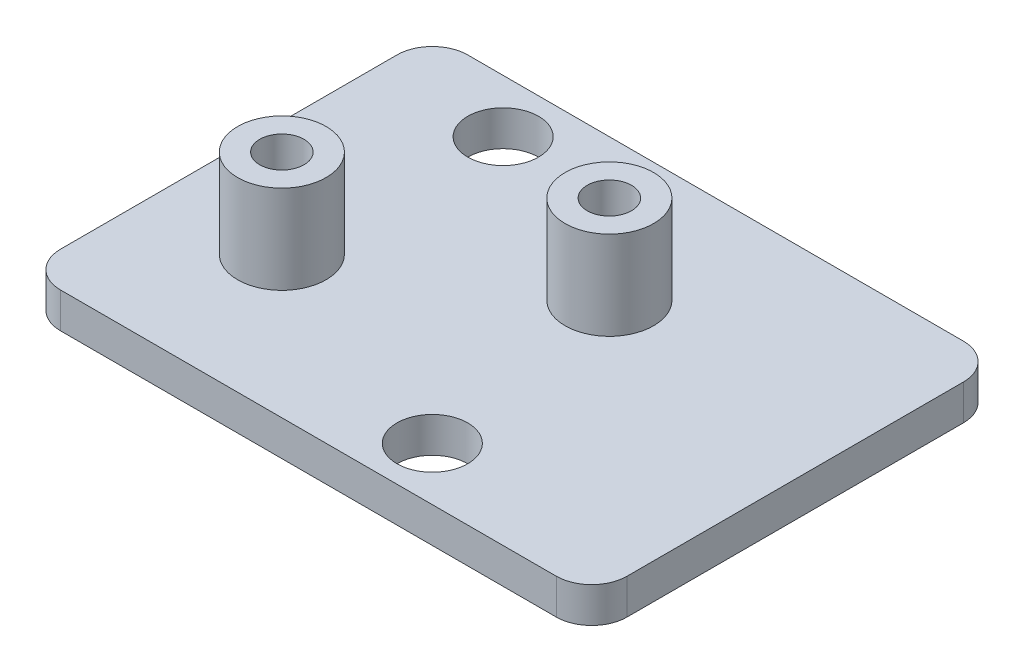
from build123d import *

# Parameters (mm, degrees)
SKETCH_1_W          = 32
SKETCH_1_H          = 23
EXTRUDE_1_DEPTH     = 2
SKETCH_4_R          = 2.5
EXTRUDE_2_DEPTH     = 5
SKETCH_5_R          = 1.25
CUT_EXTRUDE_1_DEPTH = 41.024992192
SKETCH_7_R          = 2
CUT_EXTRUDE_2_DEPTH = 40.724048132
FILLET_1_R          = 2
FILLET_2_R          = 2
FILLET_3_R          = 2
FILLET_4_R          = 2


with BuildPart() as part:
    # Эскиз1 → Бобышка-Вытянуть1 (new body)
    with BuildSketch(Plane(origin=(0, 0, 0), x_dir=(1, 0, 0), z_dir=(0, 1, 0))):
        with Locations((16, -11.5)):
            Rectangle(SKETCH_1_W, SKETCH_1_H)
    extrude(amount=EXTRUDE_1_DEPTH)

    # Эскиз4 → Бобышка-Вытянуть2 (add)
    with BuildSketch(Plane(origin=(0, 2, 0), x_dir=(1, 0, 0), z_dir=(0, 1, 0))):
        with Locations((18, -8)):
            Circle(SKETCH_4_R)
        with Locations((6.5, -15)):
            Circle(SKETCH_4_R)
    extrude(amount=EXTRUDE_2_DEPTH)

    # Эскиз5 → Вырез-Вытянуть1 (cut, through all)
    with BuildSketch(Plane(origin=(0, 7, 0), x_dir=(1, 0, 0), z_dir=(0, 1, 0))):
        with Locations((6.5, -15)):
            Circle(SKETCH_5_R)
        with Locations((18, -8)):
            Circle(SKETCH_5_R)
    extrude(amount=-CUT_EXTRUDE_1_DEPTH, mode=Mode.SUBTRACT)

    # Эскиз7 → Вырез-Вытянуть2 (cut, through all)
    with BuildSketch(Plane(origin=(0, 2, 0), x_dir=(1, 0, 0), z_dir=(0, 1, 0))):
        with Locations((7, -3)):
            Circle(SKETCH_7_R)
        with Locations((20, -20)):
            Circle(SKETCH_7_R)
    extrude(amount=-CUT_EXTRUDE_2_DEPTH, mode=Mode.SUBTRACT)

    # Скругление1
    fillet_1_edges = [part.edges().sort_by_distance(p)[0] for p in [
        (0, 1, 0),
    ]]
    fillet(fillet_1_edges, radius=FILLET_1_R)

    # Скругление2
    fillet_2_edges = [part.edges().sort_by_distance(p)[0] for p in [
        (0, 1, 23),
    ]]
    fillet(fillet_2_edges, radius=FILLET_2_R)

    # Скругление3
    fillet_3_edges = [part.edges().sort_by_distance(p)[0] for p in [
        (32, 1, 23),
    ]]
    fillet(fillet_3_edges, radius=FILLET_3_R)

    # Скругление4
    fillet_4_edges = [part.edges().sort_by_distance(p)[0] for p in [
        (32, 1, 0),
    ]]
    fillet(fillet_4_edges, radius=FILLET_4_R)


solid = part.part
